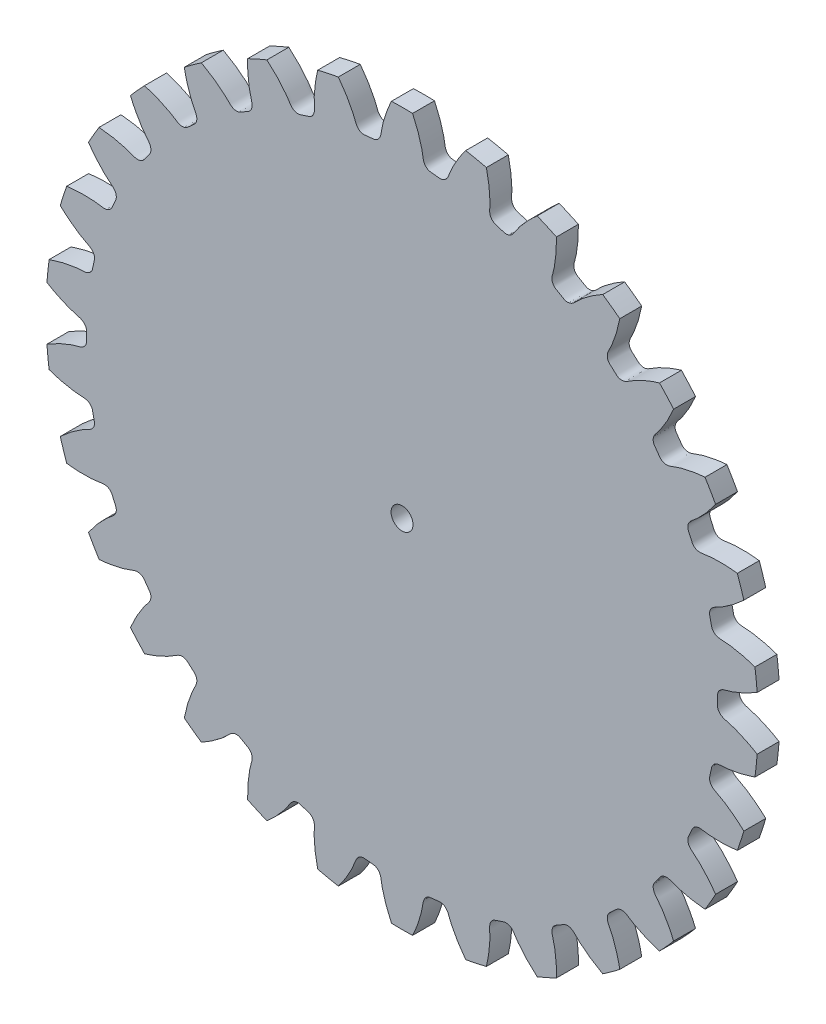
from build123d import *

# Parameters (mm, degrees)
SKETCHREVOLVEGEARTRAX1GEAR_W       = 8
SKETCHREVOLVEGEARTRAX1GEAR_H       = 129.944993333
TOOTHEXTRUDECUTGEARTRAX1GEAR_DEPTH = 4
PATTERNGEARTRAX1GEAR_COUNT         = 30
BOREREVOLVESKETCH_W                = 8
BOREREVOLVESKETCH_H                = 4


with BuildPart() as part:
    # SketchRevolveGeartrax1Gear → Geartrax1Gear (revolve)
    with BuildSketch(Plane(origin=(0, 0, 0), x_dir=(0, 0, -1), z_dir=(1, 0, 0))):
        with Locations((0, 64.972496667)):
            Rectangle(SKETCHREVOLVEGEARTRAX1GEAR_W, SKETCHREVOLVEGEARTRAX1GEAR_H)
    revolve(axis=Axis((0, 0, 0), (0, 0, -1)))

    # SketchToothGeartrax1Gear → ToothExtrudeCutGeartrax1Gear (cut, symmetric)
    with BuildSketch(Plane.XY):
        with BuildLine():
            ThreePointArc((129.893951855, 9.943239415), (130.273968, 0), (129.893951855, -9.943239415))
            add(Edge.make_bspline(
                [(129.893951855, -9.943239415), (129.023195808, -9.409257037), (127.865999799, -8.739729241), (126.41762753, -7.973090063), (125.608524708, -7.563438909), (124.82649917, -7.18515925), (124.072412054, -6.837128714), (123.347092251, -6.51820303), (122.651336098, -6.227218986), (121.98590786, -5.962991668), (121.35153574, -5.724326599), (120.748923803, -5.509981871), (120.178709387, -5.318801189), (119.641606235, -5.149265147), (119.137919181, -5.00101136), (118.457940177, -4.810580754), (117.868030022, -4.683485164), (117.38446109, -4.516922433), (117.183695518, -4.43865656), (116.982048456, -4.349319117), (116.777759856, -4.24606692), (116.568951306, -4.124827784), (116.353911285, -3.979925854), (116.131720323, -3.803566925), (115.903482569, -3.585504004), (115.674518318, -3.313432195), (115.457055123, -2.975197474), (115.273456409, -2.564278555), (115.153917884, -2.103400497), (115.103155426, -1.238882426), (115.170535137, 0), (115.103155426, 1.238882426), (115.153917884, 2.103400497), (115.273456409, 2.564278555), (115.457055123, 2.975197474), (115.674518318, 3.313432195), (115.903482569, 3.585504004), (116.131720323, 3.803566925), (116.353911285, 3.979925854), (116.568951306, 4.124827784), (116.777759856, 4.24606692), (116.982048456, 4.349319117), (117.183695518, 4.43865656), (117.38446109, 4.516922433), (117.868030022, 4.683485164), (118.457940177, 4.810580754), (119.137919181, 5.00101136), (119.641606235, 5.149265147), (120.178709387, 5.318801189), (120.748923803, 5.509981871), (121.35153574, 5.724326599), (121.98590786, 5.962991668), (122.651336098, 6.227218986), (123.347092251, 6.51820303), (124.072412054, 6.837128714), (124.82649917, 7.18515925), (125.608524708, 7.563438909), (126.41762753, 7.973090063), (127.865999799, 8.739729241), (129.023195808, 9.409257037), (129.893951855, 9.943239415)],
                knots=[0, 0, 0, 0, 0.07965202, 0.104218255, 0.127791901, 0.150372957, 0.171961423, 0.192557299, 0.212160586, 0.230771282, 0.248389389, 0.265014906, 0.280647833, 0.29528817, 0.308935917, 0.321591075, 0.35036196, 0.35588108, 0.361459251, 0.367162284, 0.373074036, 0.37930146, 0.385980133, 0.393278697, 0.401398083, 0.410556758, 0.420947396, 0.432651188, 0.44552217, 0.457824257, 0.5, 0.542175743, 0.55447783, 0.567348812, 0.579052604, 0.589443242, 0.598601917, 0.606721303, 0.614019867, 0.62069854, 0.626925964, 0.632837716, 0.638540749, 0.64411892, 0.64963804, 0.678408925, 0.691064083, 0.70471183, 0.719352167, 0.734985094, 0.751610611, 0.769228718, 0.787839414, 0.807442701, 0.828038577, 0.849627043, 0.872208099, 0.895781745, 0.92034798, 1, 1, 1, 1], degree=3))
        make_face()
    toothextrudecutgeartrax1gear = extrude(amount=TOOTHEXTRUDECUTGEARTRAX1GEAR_DEPTH, both=True, mode=Mode.SUBTRACT)

    # PatternGeartrax1Gear: ToothExtrudeCutGeartrax1Gear ×30 about axis
    patterngeartrax1gear_axis = Axis((0, 0, 55), (0, 0, -1))
    for i in range(1, PATTERNGEARTRAX1GEAR_COUNT):
        add(toothextrudecutgeartrax1gear.rotate(patterngeartrax1gear_axis, i * 360 / PATTERNGEARTRAX1GEAR_COUNT), mode=Mode.SUBTRACT)

    # BoreRevolveSketch → BoreRevolveCut (revolve, cut)
    with BuildSketch(Plane(origin=(0, 0, 0), x_dir=(0, 0, -1), z_dir=(1, 0, 0))):
        with Locations((0, 2)):
            Rectangle(BOREREVOLVESKETCH_W, BOREREVOLVESKETCH_H)
    revolve(axis=Axis((0, 0, 0), (0, 0, -1)), mode=Mode.SUBTRACT)


solid = part.part
